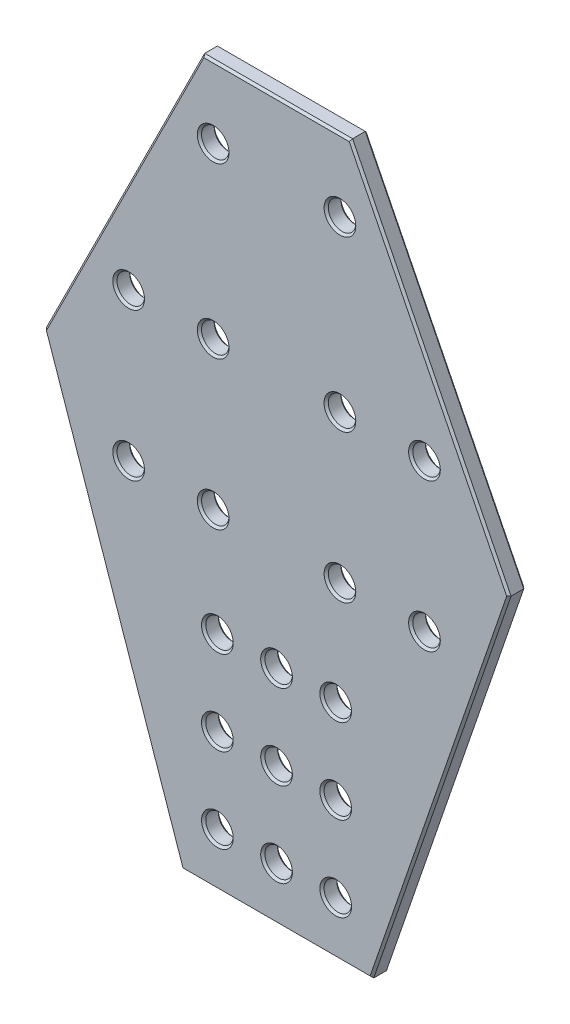
from build123d import *

# Parameters (mm, degrees)
SKETCH_1_R        = 13
EXTRUDE_872_DEPTH = 16
CHAMFER_1_SIZE    = 2


with BuildPart() as part:
    # 草图1 → Extrude 872 (new body)
    with BuildSketch(Plane.XY):
        Polygon((-70, 228), (70, 228), (220, -72), (90, -450), (-90, -450), (-220, -72), align=None)
        with Locations((-140, 0)):
            Circle(SKETCH_1_R, mode=Mode.SUBTRACT)
        with Locations((-60, 0)):
            Circle(SKETCH_1_R, mode=Mode.SUBTRACT)
        with Locations((60, -140)):
            Circle(SKETCH_1_R, mode=Mode.SUBTRACT)
        with Locations((140, -140)):
            Circle(SKETCH_1_R, mode=Mode.SUBTRACT)
        with Locations((-140, -140)):
            Circle(SKETCH_1_R, mode=Mode.SUBTRACT)
        with Locations((-60, -140)):
            Circle(SKETCH_1_R, mode=Mode.SUBTRACT)
        with Locations((60, 0)):
            Circle(SKETCH_1_R, mode=Mode.SUBTRACT)
        with Locations((140, 0)):
            Circle(SKETCH_1_R, mode=Mode.SUBTRACT)
        with Locations((0, -400)):
            Circle(SKETCH_1_R, mode=Mode.SUBTRACT)
        with Locations((0, -240)):
            Circle(SKETCH_1_R, mode=Mode.SUBTRACT)
        with Locations((60, 160)):
            Circle(SKETCH_1_R, mode=Mode.SUBTRACT)
        with Locations((0, -320)):
            Circle(SKETCH_1_R, mode=Mode.SUBTRACT)
        with Locations((-60, 160)):
            Circle(SKETCH_1_R, mode=Mode.SUBTRACT)
        with Locations((56, -240)):
            Circle(SKETCH_1_R, mode=Mode.SUBTRACT)
        with Locations((56, -320)):
            Circle(SKETCH_1_R, mode=Mode.SUBTRACT)
        with Locations((56, -400)):
            Circle(SKETCH_1_R, mode=Mode.SUBTRACT)
        with Locations((-56, -400)):
            Circle(SKETCH_1_R, mode=Mode.SUBTRACT)
        with Locations((-56, -320)):
            Circle(SKETCH_1_R, mode=Mode.SUBTRACT)
        with Locations((-56, -240)):
            Circle(SKETCH_1_R, mode=Mode.SUBTRACT)
    extrude(amount=EXTRUDE_872_DEPTH)

    # 倒角1
    chamfer_1_edges = [part.edges().sort_by_distance(p)[0] for p in [
        (-69, -240, 0),
        (-69, -400, 0),
        (43, -320, 0),
        (-73, 160, 0),
        (-13, -320, 0),
        (-13, -400, 0),
        (47, 0, 0),
        (-153, -140, 0),
        (47, -140, 0),
        (-153, 0, 0),
        (-155, -261, 0),
        (0, -450, 0),
        (155, -261, 0),
        (145, 78, 0),
        (0, 228, 0),
        (-145, 78, 0),
        (-73, 0, 0),
        (127, -140, 0),
        (-73, -140, 0),
        (127, 0, 0),
        (-13, -240, 0),
        (47, 160, 0),
        (43, -240, 0),
        (43, -400, 0),
        (-69, -320, 0),
        (-69, -240, 16),
        (-69, -400, 16),
        (43, -320, 16),
        (-73, 160, 16),
        (-13, -320, 16),
        (-13, -400, 16),
        (47, 0, 16),
        (-153, -140, 16),
        (47, -140, 16),
        (-153, 0, 16),
        (0, 228, 16),
        (145, 78, 16),
        (155, -261, 16),
        (0, -450, 16),
        (-155, -261, 16),
        (-145, 78, 16),
        (-73, 0, 16),
        (127, -140, 16),
        (-73, -140, 16),
        (127, 0, 16),
        (-13, -240, 16),
        (47, 160, 16),
        (43, -240, 16),
        (43, -400, 16),
        (-69, -320, 16),
    ]]
    chamfer(chamfer_1_edges, length=CHAMFER_1_SIZE)


solid = part.part
